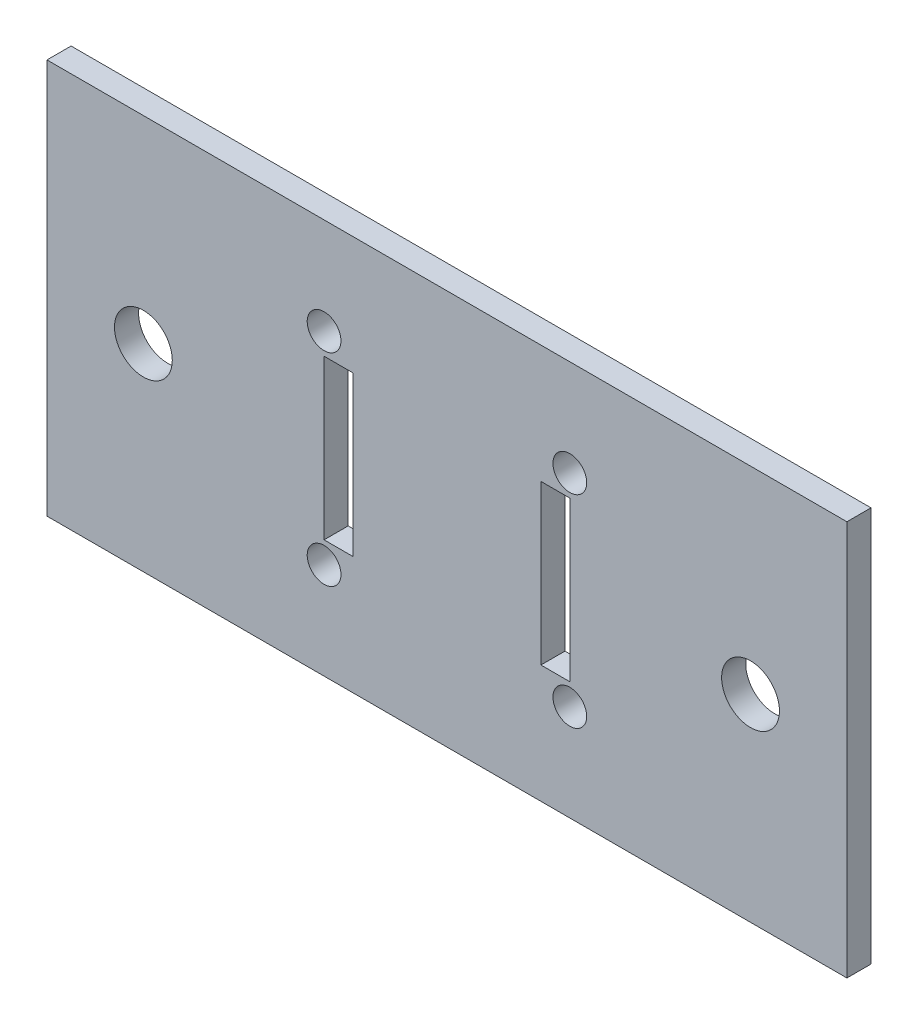
from build123d import *

# Parameters (mm, degrees)
SKETCH1_W           = 83
SKETCH1_H           = 41
SKETCH1_R           = 3
SKETCH1_R_2         = 1.75
SKETCH1_W_2         = 3
SKETCH1_H_2         = 16.5
BOSS_EXTRUDE1_DEPTH = 2.5


with BuildPart() as part:
    # Sketch1 → Boss-Extrude1 (new body)
    with BuildSketch(Plane.XY):
        Rectangle(SKETCH1_W, SKETCH1_H)
        with Locations((-31.5, 0)):
            Circle(SKETCH1_R, mode=Mode.SUBTRACT)
        with Locations((31.5, 0)):
            Circle(SKETCH1_R, mode=Mode.SUBTRACT)
        with Locations((-12.75, 10.5)):
            Circle(SKETCH1_R_2, mode=Mode.SUBTRACT)
        with Locations((12.75, 10.5)):
            Circle(SKETCH1_R_2, mode=Mode.SUBTRACT)
        with Locations((12.75, -10.5)):
            Circle(SKETCH1_R_2, mode=Mode.SUBTRACT)
        with Locations((-12.75, -10.5)):
            Circle(SKETCH1_R_2, mode=Mode.SUBTRACT)
        with Locations((-11.25, 0)):
            Rectangle(SKETCH1_W_2, SKETCH1_H_2, mode=Mode.SUBTRACT)
        with Locations((11.25, 0)):
            Rectangle(SKETCH1_W_2, SKETCH1_H_2, mode=Mode.SUBTRACT)
    extrude(amount=BOSS_EXTRUDE1_DEPTH)


solid = part.part
